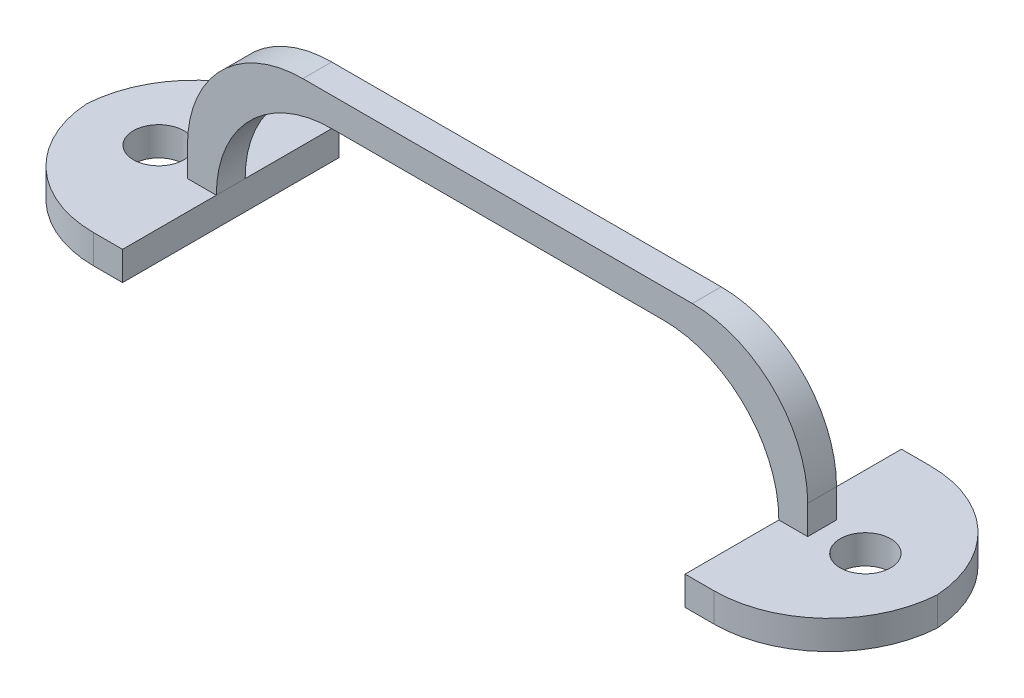
from build123d import *

# Parameters (mm, degrees)
SKETCH3_W                = 10
SKETCH3_H                = 15
SKETCH3_R                = 1.75
BOSS_EXTRUDE1_DEPTH      = 2
BOSS_EXTRUDE1_2_DEPTH    = 2
BOSS_EXTRUDE2_DEPTH      = 1
BOSS_EXTRUDE2_DEPTH_BACK = 1
FILLET1_R                = 8


with BuildPart() as part:
    # Sketch3 → Boss-Extrude1 (new body)
    with BuildSketch(Plane(origin=(0, 0, 0), x_dir=(1, 0, 0), z_dir=(0, 1, 0))):
        with Locations((-17.609522653, -8.672957347)):
            Rectangle(SKETCH3_W, SKETCH3_H)
        with Locations(Location((-17.609522653, -8.672957347, 0), (0, 0, 270))):
            Circle(SKETCH3_R, mode=Mode.SUBTRACT)
    extrude(amount=BOSS_EXTRUDE1_DEPTH)



with BuildPart() as body_2:
    # Sketch3 → Boss-Extrude1 2 (new body)
    with BuildSketch(Plane(origin=(0, 0, 0), x_dir=(1, 0, 0), z_dir=(0, 1, 0))):
        with Locations((31.390477347, -8.672957347)):
            Rectangle(SKETCH3_W, SKETCH3_H)
        with Locations(Location((31.390477347, -8.672957347, 0), (0, 0, 270))):
            Circle(SKETCH3_R, mode=Mode.SUBTRACT)
    extrude(amount=BOSS_EXTRUDE1_2_DEPTH)


with BuildPart() as part_1:
    add(part.part)

    add(body_2.part)  # Boss-Extrude2 merges body 2
    # Sketch4 → Boss-Extrude2 (add, two sides: drawn at the far end of the back side and taken through both)
    with BuildSketch(Plane.XY.offset(8.672957347).offset(-BOSS_EXTRUDE2_DEPTH_BACK)):
        Polygon((-12.609522653, 2), (-12.609522653, 10), (26.390477347, 10), (26.390477347, 2), (28.390477347, 2), (28.390477347, 12), (-14.609522653, 12), (-14.609522653, 2), align=None)
    extrude(amount=BOSS_EXTRUDE2_DEPTH + BOSS_EXTRUDE2_DEPTH_BACK)

    # Fillet1
    # the kernel refuses this fillet: 8 mm, written as the material it adds along each edge
    with BuildSketch(Plane(origin=(26.390477347, 10, 7.672957347), x_dir=(0, -1, 0), z_dir=(0, 0, 1)), Plane(origin=(-12.609522653, 10, 7.672957347), x_dir=(1, 0, 0), z_dir=(0, 0, 1))) as fillet1_piece_1:
        with BuildLine():
            CenterArc((FILLET1_R, -FILLET1_R), FILLET1_R, 90, 90)
            Line((0, -FILLET1_R), (0, 0))
            Line((0, 0), (FILLET1_R, 0))
        make_face()
    extrude(amount=2)
    # the kernel refuses this fillet: 8 mm, written as the material it takes off along each edge
    with BuildSketch(Plane(origin=(-22.609522653, -20, 1.172957347), x_dir=(0, 0, 1), z_dir=(0, 1, 0)), Plane(origin=(36.390477347, -20, 1.172957347), x_dir=(-1, 0, 0), z_dir=(0, 1, 0)), Plane(origin=(36.390477347, -20, 16.172957347), x_dir=(0, 0, -1), z_dir=(0, 1, 0)), Plane(origin=(-14.609522653, 12, 29.672957347), x_dir=(1, 0, 0), z_dir=(0, 0, -1))) as fillet1_2_piece_1:
        with BuildLine():
            CenterArc((FILLET1_R, FILLET1_R), FILLET1_R, 180, 90)
            Line((0, FILLET1_R), (0, 0))
            Line((0, 0), (FILLET1_R, 0))
        make_face()
    extrude(amount=42, mode=Mode.SUBTRACT)
    with BuildSketch(Plane(origin=(-22.609522653, -20, 16.172957347), x_dir=(0, 0, -1), z_dir=(0, 1, 0)), Plane(origin=(28.390477347, 12, -12.327042653), x_dir=(0, -1, 0), z_dir=(0, 0, 1))) as fillet1_2_piece_2:
        with BuildLine():
            CenterArc((FILLET1_R, -FILLET1_R), FILLET1_R, 90, 90)
            Line((0, -FILLET1_R), (0, 0))
            Line((0, 0), (FILLET1_R, 0))
        make_face()
    extrude(amount=42, mode=Mode.SUBTRACT)


solid = part_1.part
